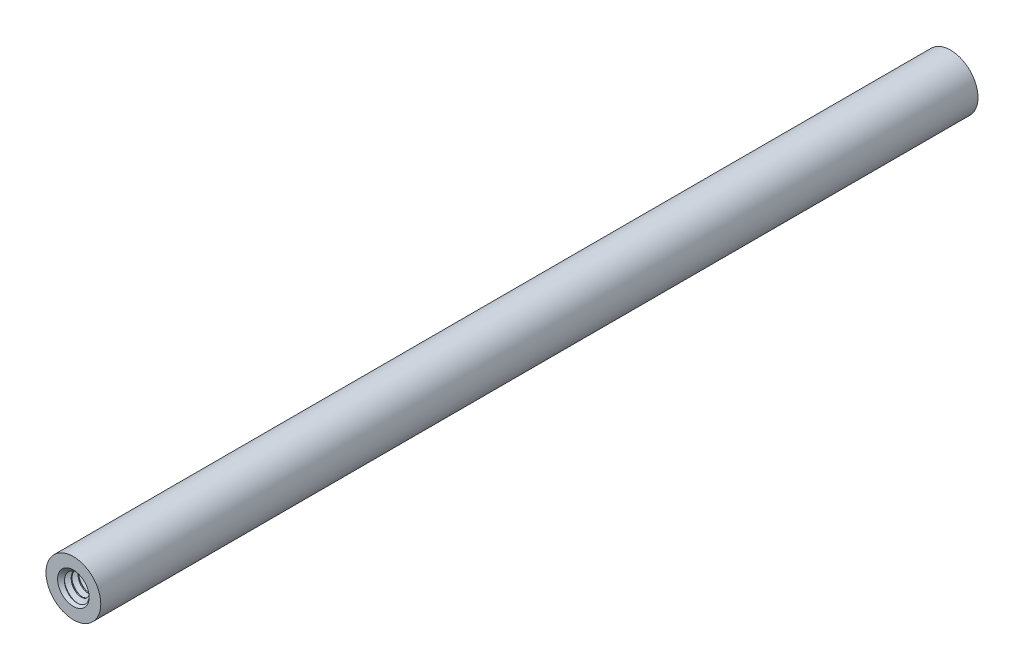
from build123d import *

# Parameters (mm, degrees)
BOSS_EXTRUDE1_START = 50.8
SKETCH13_R          = 1.7526
BOSS_EXTRUDE1_DEPTH = 9.525
CUT_SWEEP1_PITCH    = 0.79375
CIRPATTERN1_COUNT   = 2
CIRPATTERN1_ANGLE   = 180
EXTRUDE1_DEPTH      = 50.8
EXTRUDE1_DEPTH_BACK = 50.8
SKETCH1_R           = 3.175


with BuildPart() as part:
    # Sketch13 → Boss-Extrude1 (new body)
    with BuildSketch(Plane.XY.offset(BOSS_EXTRUDE1_START)):
        Circle(SKETCH13_R)
    extrude(amount=-BOSS_EXTRUDE1_DEPTH)

    # Cut-Sweep1: the profile of Sketch15 profile screwed along a right-hand helix of 13 turns, 8 arcs to a turn; built about Z, then put on its axis
    cut_sweep1_z = Axis((0, 0, 0), (0, 0, 1))
    cut_sweep1_corners = [(1.7529, 0, -0.694704455), (1.7529, 0, 0.000173205), (1.237044252, 0, -0.29765625), (1.237044252, 0, -0.396875)]
    with BuildLine(mode=Mode.PRIVATE) as cut_sweep1_profile:
        Line(cut_sweep1_corners[0], cut_sweep1_corners[1])
        Line(cut_sweep1_corners[1], cut_sweep1_corners[2])
        Line(cut_sweep1_corners[2], cut_sweep1_corners[3])
        Line(cut_sweep1_corners[3], cut_sweep1_corners[0])
    cut_sweep1_cap = Face(cut_sweep1_profile.wire())
    cut_sweep1_turn_angles = [0, 22.5, 45, 67.5, 90, 112.5, 135, 157.5, 180, 202.5, 225, 247.5, 270, 292.5, 315, 337.5, 360]
    cut_sweep1_turn_weights = [1, 0.9238795325112867, 1, 0.9238795325112867, 1, 0.9238795325112867, 1, 0.9238795325112867, 1, 0.9238795325112867, 1, 0.9238795325112867, 1, 0.9238795325112867, 1, 0.9238795325112867, 1]
    cut_sweep1_turn_rails = [Edge.make_bspline([Vector(p[0], p[1], 0).rotate(cut_sweep1_z, cut_sweep1_turn_angles[k]) / cut_sweep1_turn_weights[k] + Vector(0, 0, p[2] + CUT_SWEEP1_PITCH * cut_sweep1_turn_angles[k] / 360) for k in range(17)], [0, 0, 0, 1, 1, 2, 2, 3, 3, 4, 4, 5, 5, 6, 6, 7, 7, 8, 8, 8], 2, cut_sweep1_turn_weights) for p in cut_sweep1_corners]
    cut_sweep1_turn_sides = [Face.make_surface_from_curves(cut_sweep1_turn_rails[p[0]], cut_sweep1_turn_rails[p[1]]) for p in [(0, 1), (1, 2), (2, 3), (3, 0)]]
    cut_sweep1 = Plane(origin=(0, 0, 50.8), x_dir=(0, 1, 0), z_dir=(0, 0, -1)) * Solid(Shell([*[p.moved(Location((0, 0, CUT_SWEEP1_PITCH * i))) for i in range(13) for p in cut_sweep1_turn_sides], cut_sweep1_cap, cut_sweep1_cap.rotate(cut_sweep1_z, 4680).moved(Location((0, 0, CUT_SWEEP1_PITCH * 4680 / 360)))]))
    add(cut_sweep1, mode=Mode.SUBTRACT)

    # Boss-Extrude2 cone 1 section (through the dimple's axis) → Boss-Extrude2 (revolve)
    with BuildSketch(Plane(origin=(0, 0, 50.8), x_dir=(0, -1, 0), z_dir=(1, 0, 0))):
        Polygon((0, 0), (1.8288, 0), (0, 1.8288), align=None)
    revolve(axis=Axis((0, 0, 50.8), (0, 0, -1)))


with BuildPart() as cirpattern1_1:
    # CirPattern1: pattern copy
    add(part.part.rotate(Axis((0, 3.175, 0), (0, -1, 0)), 1 * CIRPATTERN1_ANGLE / (CIRPATTERN1_COUNT - 1)))


with BuildPart() as body_3:
    # Sketch1 → Extrude1 (new, two sides: drawn at the far end of the back side and taken through both)
    with BuildSketch(Plane.XY.offset(-EXTRUDE1_DEPTH_BACK)):
        Circle(SKETCH1_R)
    extrude(amount=EXTRUDE1_DEPTH + EXTRUDE1_DEPTH_BACK)

    # Combine1: cut CirPattern1_1, part
    add(cirpattern1_1.part, mode=Mode.SUBTRACT)
    add(part.part, mode=Mode.SUBTRACT)


solid = body_3.part
